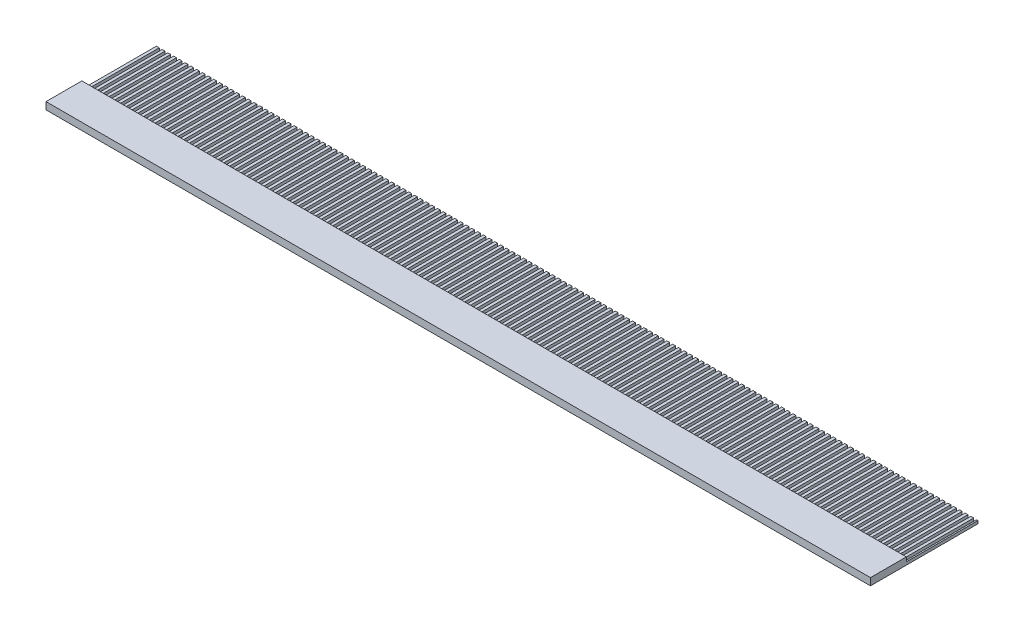
from build123d import *

# Parameters (mm, degrees)
SKETCH1_W           = 115
SKETCH1_H           = 15
BOSS_EXTRUDE1_DEPTH = 0.5
SKETCH2_W           = 115
SKETCH2_H           = 10
CUT_EXTRUDE1_DEPTH  = 0.1
SKETCH3_W           = 0.4
SKETCH3_H           = 10
CUT_EXTRUDE2_DEPTH  = 0.4
LPATTERN3_COUNT     = 150
LPATTERN3_PITCH     = 0.8
SKETCH4_W           = 115
SKETCH4_H           = 5
BOSS_EXTRUDE2_DEPTH = 1


with BuildPart() as part:
    # Sketch1 → Boss-Extrude1 (new body)
    with BuildSketch(Plane(origin=(0, 0, 0), x_dir=(1, 0, 0), z_dir=(0, 1, 0))):
        with Locations((57.5, 7.5)):
            Rectangle(SKETCH1_W, SKETCH1_H)
    extrude(amount=BOSS_EXTRUDE1_DEPTH)

    # Sketch2 → Cut-Extrude1 (cut)
    with BuildSketch(Plane(origin=(0, 0.5, 0), x_dir=(1, 0, 0), z_dir=(0, 1, 0))):
        with Locations((57.5, 10)):
            Rectangle(SKETCH2_W, SKETCH2_H)
    extrude(amount=-CUT_EXTRUDE1_DEPTH, mode=Mode.SUBTRACT)

    # Sketch3 → Cut-Extrude2 (cut)
    with BuildSketch(Plane(origin=(0, 0.4, 0), x_dir=(1, 0, 0), z_dir=(0, 1, 0))):
        with Locations((0.2, 10)):
            Rectangle(SKETCH3_W, SKETCH3_H)
    cut_extrude2 = extrude(amount=-CUT_EXTRUDE2_DEPTH, mode=Mode.SUBTRACT)

    # LPattern3: Cut-Extrude2 ×150
    with Locations(*[(i * LPATTERN3_PITCH, 0, 0) for i in range(1, LPATTERN3_COUNT)]):
        add(cut_extrude2, mode=Mode.SUBTRACT)

    # Sketch4 → Boss-Extrude2 (add)
    with BuildSketch(Plane.XZ):
        with Locations((57.5, -2.5)):
            Rectangle(SKETCH4_W, SKETCH4_H)
    extrude(amount=-BOSS_EXTRUDE2_DEPTH)


solid = part.part
